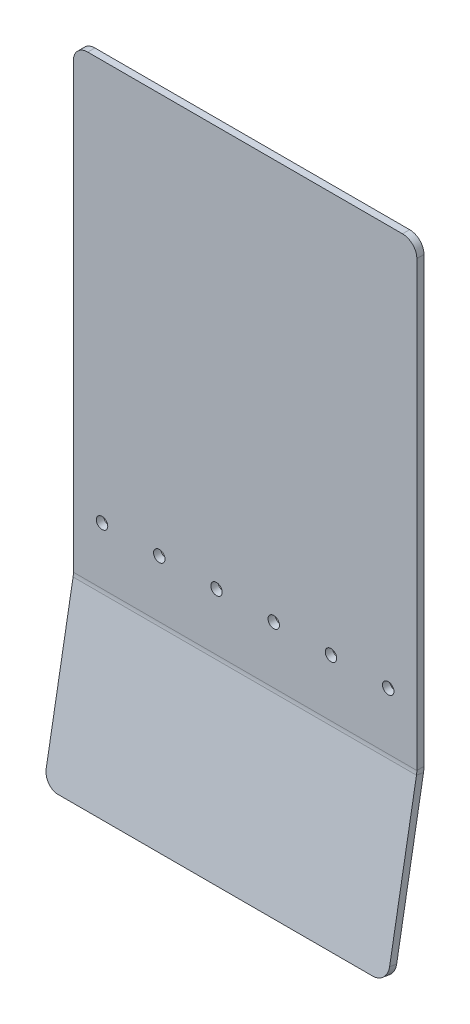
from build123d import *

# Parameters (mm, degrees)
SKETCH1_W            = 152.4
SKETCH1_H            = 222.25
SKETCH1_R            = 2.54
BOSS_EXTRUDE1_DEPTH  = 3.175
FILLET1_R            = 6.35
EDGE_FLANGE1_DEPTH   = 152.4
EDGE_FLANGE1_2_DEPTH = 152.4
FILLET2_R            = 6.35


# Read off the part's stored shape, not the designer's step: Edge-Flange1
with BuildPart() as part:
    # Sketch1 → Boss-Extrude1 (new body)
    with BuildSketch(Plane.XY):
        with Locations((76.2, 111.125)):
            Rectangle(SKETCH1_W, SKETCH1_H)
        with Locations((12.7, 44.45)):
            Circle(SKETCH1_R, mode=Mode.SUBTRACT)
        with Locations((38.1, 44.45)):
            Circle(SKETCH1_R, mode=Mode.SUBTRACT)
        with Locations((63.5, 44.45)):
            Circle(SKETCH1_R, mode=Mode.SUBTRACT)
        with Locations((88.9, 44.45)):
            Circle(SKETCH1_R, mode=Mode.SUBTRACT)
        with Locations((114.3, 44.45)):
            Circle(SKETCH1_R, mode=Mode.SUBTRACT)
        with Locations((139.7, 44.45)):
            Circle(SKETCH1_R, mode=Mode.SUBTRACT)
    extrude(amount=BOSS_EXTRUDE1_DEPTH)

    # Fillet1
    fillet1_edges = [part.edges().sort_by_distance(p)[0] for p in [
        (0, 222.25, 1.5875),
        (152.4, 222.25, 1.5875),
    ]]
    fillet(fillet1_edges, radius=FILLET1_R)

    # Edge-Flange1 outline → Edge-Flange1 (cut)
    with BuildSketch(Plane.YZ):
        with BuildLine():
            ThreePointArc((19.158982919, 0), (18.010706008, 0.050134853), (16.871168178, 0.200157854))
            Line((16.871168178, 0.200157854), (0, 3.175))
            Line((0, 3.175), (0, 0))
            Line((0, 0), (19.158982919, 0))
        make_face()
    extrude(amount=EDGE_FLANGE1_DEPTH, mode=Mode.SUBTRACT)

    # Edge-Flange1 2 outline → Edge-Flange1 2 (add)
    with BuildSketch(Plane.YZ):
        with BuildLine():
            Line((-57.036031002, 13.231991138), (0, 3.175))
            Line((0, 3.175), (19.158982919, 3.175))
            ThreePointArc((19.158982919, 3.175), (18.287425492, 3.213053019), (17.422501143, 3.32692247))
            Line((17.422501143, 3.32692247), (-56.484698038, 16.358755754))
            Line((-56.484698038, 16.358755754), (-57.036031002, 13.231991138))
        make_face()
    extrude(amount=EDGE_FLANGE1_2_DEPTH)

    # Fillet2
    fillet2_edges = [part.edges().sort_by_distance(p)[0] for p in [
        (0, -56.76036452, 14.795373446),
        (152.4, -56.76036452, 14.795373446),
    ]]
    fillet(fillet2_edges, radius=FILLET2_R)


solid = part.part
